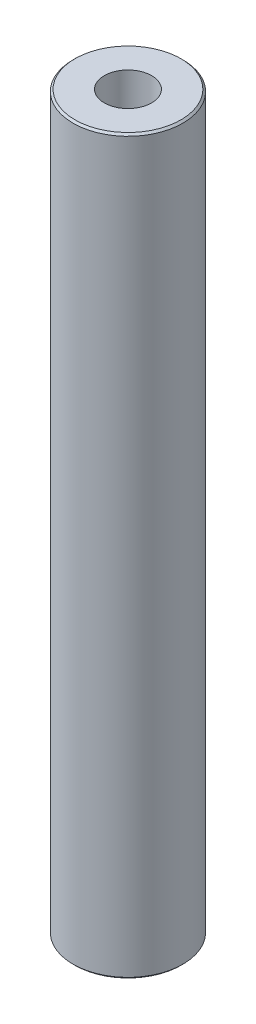
from build123d import *

# Parameters (mm, degrees)
SKETCH1_R           = 45
BOSS_EXTRUDE1_DEPTH = 600
SKETCH2_R           = 19.396647908
CUT_EXTRUDE1_DEPTH  = 604.365560834
CHAMFER1_SIZE       = 1.58084576


with BuildPart() as part:
    # Sketch1 → Boss-Extrude1 (new body)
    with BuildSketch(Plane(origin=(0, 0, 0), x_dir=(1, 0, 0), z_dir=(0, 1, 0))):
        Circle(SKETCH1_R)
    extrude(amount=BOSS_EXTRUDE1_DEPTH)

    # Sketch2 → Cut-Extrude1 (cut, through all)
    with BuildSketch(Plane(origin=(0, 0, 0), x_dir=(1, 0, 0), z_dir=(0, 1, 0))):
        Circle(SKETCH2_R)
    extrude(amount=CUT_EXTRUDE1_DEPTH, mode=Mode.SUBTRACT)

    # Chamfer1
    chamfer1_edges = [part.edges().sort_by_distance(p)[0] for p in [
        (-45, 600, 0),
        (-45, 0, 0),
    ]]
    chamfer(chamfer1_edges, length=CHAMFER1_SIZE)


solid = part.part
